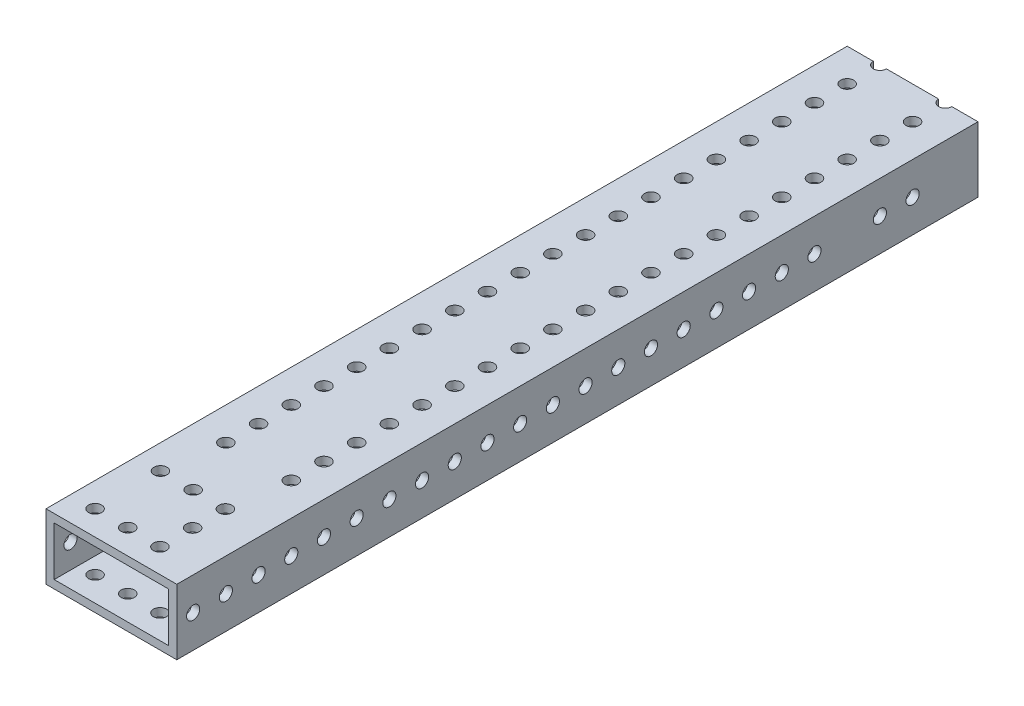
from build123d import *

# Parameters (mm, degrees)
SKETCH1_W           = 50.8
SKETCH1_H           = 25.4
SKETCH1_W_2         = 44.45
SKETCH1_H_2         = 19.05
BOSS_EXTRUDE1_DEPTH = 234.95
SKETCH6_R           = 2.5527
CUT_EXTRUDE5_DEPTH  = 241.714421047
SKETCH5_W           = 63.5
SKETCH5_H           = 25.4
CUT_EXTRUDE6_DEPTH  = 241.714421047
SKETCH2_R           = 2.5527
CUT_EXTRUDE1_DEPTH  = 238.680084357
SKETCH7_W           = 95.25
SKETCH7_H           = 25.4
CUT_EXTRUDE7_DEPTH  = 241.714421047


with BuildPart() as part:
    # Sketch1 → Boss-Extrude1 (new, symmetric)
    with BuildSketch(Plane.XY):
        Rectangle(SKETCH1_W, SKETCH1_H)
        Rectangle(SKETCH1_W_2, SKETCH1_H_2, mode=Mode.SUBTRACT)
    extrude(amount=BOSS_EXTRUDE1_DEPTH, both=True)

    # Sketch6 → Cut-Extrude5 (cut, through all)
    with BuildSketch(Plane(origin=(25.4, 0, 0), x_dir=(0, 0, -1), z_dir=(1, 0, 0))):
        with Locations((-228.6, 0)):
            Circle(SKETCH6_R)
        with Locations((-215.9, 0)):
            Circle(SKETCH6_R)
        with Locations((-203.2, 0)):
            Circle(SKETCH6_R)
        with Locations((-190.5, 0)):
            Circle(SKETCH6_R)
        with Locations((-177.8, 0)):
            Circle(SKETCH6_R)
        with Locations((-165.1, 0)):
            Circle(SKETCH6_R)
        with Locations((-152.4, 0)):
            Circle(SKETCH6_R)
        with Locations((-139.7, 0)):
            Circle(SKETCH6_R)
        with Locations((-127, 0)):
            Circle(SKETCH6_R)
        with Locations((-114.3, 0)):
            Circle(SKETCH6_R)
        with Locations((-101.6, 0)):
            Circle(SKETCH6_R)
        with Locations((-88.9, 0)):
            Circle(SKETCH6_R)
        with Locations((-76.2, 0)):
            Circle(SKETCH6_R)
        with Locations((-63.5, 0)):
            Circle(SKETCH6_R)
        with Locations((-50.8, 0)):
            Circle(SKETCH6_R)
        with Locations((-38.1, 0)):
            Circle(SKETCH6_R)
        with Locations((-25.4, 0)):
            Circle(SKETCH6_R)
        with Locations((-12.7, 0)):
            Circle(SKETCH6_R)
        Circle(SKETCH6_R)
        with Locations((12.7, 0)):
            Circle(SKETCH6_R)
        with Locations((38.1, 0)):
            Circle(SKETCH6_R)
        with Locations((50.8, 0)):
            Circle(SKETCH6_R)
    extrude(amount=-CUT_EXTRUDE5_DEPTH, mode=Mode.SUBTRACT)

    # Sketch5 → Cut-Extrude6 (cut, through all)
    with BuildSketch(Plane.ZY.offset(25.4)):
        with Locations((-203.2, 0)):
            Rectangle(SKETCH5_W, SKETCH5_H)
    extrude(amount=-CUT_EXTRUDE6_DEPTH, mode=Mode.SUBTRACT)

    # Sketch2 → Cut-Extrude1 (cut, through all)
    with BuildSketch(Plane(origin=(0, 12.7, 0), x_dir=(1, 0, 0), z_dir=(0, 1, 0))):
        with Locations((-12.7, -177.8)):
            Circle(SKETCH2_R)
        with Locations((-12.7, -165.1)):
            Circle(SKETCH2_R)
        with Locations((-12.7, -152.4)):
            Circle(SKETCH2_R)
        with Locations((-12.7, -139.7)):
            Circle(SKETCH2_R)
        with Locations((-12.7, -127)):
            Circle(SKETCH2_R)
        with Locations((-12.7, -114.3)):
            Circle(SKETCH2_R)
        with Locations((-12.7, -101.6)):
            Circle(SKETCH2_R)
        with Locations((-12.7, -88.9)):
            Circle(SKETCH2_R)
        with Locations((-12.7, -76.2)):
            Circle(SKETCH2_R)
        with Locations((-12.7, -63.5)):
            Circle(SKETCH2_R)
        with Locations((-12.7, -50.8)):
            Circle(SKETCH2_R)
        with Locations((-12.7, -38.1)):
            Circle(SKETCH2_R)
        with Locations((-12.7, -25.4)):
            Circle(SKETCH2_R)
        with Locations((-12.7, -12.7)):
            Circle(SKETCH2_R)
        with Locations((-12.7, 0)):
            Circle(SKETCH2_R)
        with Locations((-12.7, 12.7)):
            Circle(SKETCH2_R)
        with Locations((-12.7, 25.4)):
            Circle(SKETCH2_R)
        with Locations((12.7, 25.4)):
            Circle(SKETCH2_R)
        with Locations((-12.7, 38.1)):
            Circle(SKETCH2_R)
        with Locations((-12.7, 50.8)):
            Circle(SKETCH2_R)
        with Locations((-12.7, 63.5)):
            Circle(SKETCH2_R)
        with Locations((12.7, 63.5)):
            Circle(SKETCH2_R)
        with Locations((-12.7, 76.2)):
            Circle(SKETCH2_R)
        with Locations((12.7, 76.2)):
            Circle(SKETCH2_R)
        with Locations((-12.7, 88.9)):
            Circle(SKETCH2_R)
        with Locations((-12.7, 101.6)):
            Circle(SKETCH2_R)
        with Locations((-12.7, 114.3)):
            Circle(SKETCH2_R)
        with Locations((-12.7, 139.7)):
            Circle(SKETCH2_R)
        with Locations((-12.7, 152.4)):
            Circle(SKETCH2_R)
        with Locations((-12.7, 165.1)):
            Circle(SKETCH2_R)
        with Locations((-12.7, 177.8)):
            Circle(SKETCH2_R)
        with Locations((-12.7, 190.5)):
            Circle(SKETCH2_R)
        with Locations((-12.7, 203.2)):
            Circle(SKETCH2_R)
        with Locations((-12.7, 215.9)):
            Circle(SKETCH2_R)
        with Locations((-12.7, 228.6)):
            Circle(SKETCH2_R)
        with Locations((-12.7, 241.3)):
            Circle(SKETCH2_R)
        with Locations((-12.7, 254)):
            Circle(SKETCH2_R)
        with Locations((-12.7, 266.7)):
            Circle(SKETCH2_R)
        with Locations((-12.7, 279.4)):
            Circle(SKETCH2_R)
        with Locations((-12.7, 292.1)):
            Circle(SKETCH2_R)
        with Locations((-12.7, 304.8)):
            Circle(SKETCH2_R)
        with Locations((-12.7, 317.5)):
            Circle(SKETCH2_R)
        with Locations((-12.7, 330.2)):
            Circle(SKETCH2_R)
        with Locations((-12.7, 342.9)):
            Circle(SKETCH2_R)
        with Locations((-12.7, 355.6)):
            Circle(SKETCH2_R)
        with Locations((12.7, -177.8)):
            Circle(SKETCH2_R)
        with Locations((12.7, -165.1)):
            Circle(SKETCH2_R)
        with Locations((12.7, -152.4)):
            Circle(SKETCH2_R)
        with Locations((12.7, -139.7)):
            Circle(SKETCH2_R)
        with Locations((12.7, -127)):
            Circle(SKETCH2_R)
        with Locations((12.7, -114.3)):
            Circle(SKETCH2_R)
        with Locations((12.7, -101.6)):
            Circle(SKETCH2_R)
        with Locations((12.7, -88.9)):
            Circle(SKETCH2_R)
        with Locations((12.7, -76.2)):
            Circle(SKETCH2_R)
        with Locations((12.7, -63.5)):
            Circle(SKETCH2_R)
        with Locations((12.7, -50.8)):
            Circle(SKETCH2_R)
        with Locations((12.7, -38.1)):
            Circle(SKETCH2_R)
        with Locations((12.7, -25.4)):
            Circle(SKETCH2_R)
        with Locations((12.7, -12.7)):
            Circle(SKETCH2_R)
        with Locations((12.7, 0)):
            Circle(SKETCH2_R)
        with Locations((12.7, 12.7)):
            Circle(SKETCH2_R)
        with Locations((12.7, 38.1)):
            Circle(SKETCH2_R)
        with Locations((12.7, 50.8)):
            Circle(SKETCH2_R)
        with Locations((12.7, 88.9)):
            Circle(SKETCH2_R)
        with Locations((12.7, 101.6)):
            Circle(SKETCH2_R)
        with Locations((12.7, 114.3)):
            Circle(SKETCH2_R)
        with Locations((12.7, 139.7)):
            Circle(SKETCH2_R)
        with Locations((12.7, 152.4)):
            Circle(SKETCH2_R)
        with Locations((12.7, 165.1)):
            Circle(SKETCH2_R)
        with Locations((12.7, 177.8)):
            Circle(SKETCH2_R)
        with Locations((12.7, 190.5)):
            Circle(SKETCH2_R)
        with Locations((12.7, 203.2)):
            Circle(SKETCH2_R)
        with Locations((12.7, 215.9)):
            Circle(SKETCH2_R)
        with Locations((12.7, 228.6)):
            Circle(SKETCH2_R)
        with Locations((12.7, 241.3)):
            Circle(SKETCH2_R)
        with Locations((12.7, 254)):
            Circle(SKETCH2_R)
        with Locations((12.7, 266.7)):
            Circle(SKETCH2_R)
        with Locations((12.7, 279.4)):
            Circle(SKETCH2_R)
        with Locations((12.7, 292.1)):
            Circle(SKETCH2_R)
        with Locations((12.7, 304.8)):
            Circle(SKETCH2_R)
        with Locations((12.7, 317.5)):
            Circle(SKETCH2_R)
        with Locations((12.7, 330.2)):
            Circle(SKETCH2_R)
        with Locations((12.7, 342.9)):
            Circle(SKETCH2_R)
        with Locations((12.7, 355.6)):
            Circle(SKETCH2_R)
        with Locations((12.7, 368.3)):
            Circle(SKETCH2_R)
        with Locations((12.7, 381)):
            Circle(SKETCH2_R)
        with Locations((12.7, 393.7)):
            Circle(SKETCH2_R)
        with Locations((-15.875, -225.425)):
            Circle(SKETCH2_R)
        with Locations((-15.875, -200.025)):
            Circle(SKETCH2_R)
        with Locations((-3.175, -200.025)):
            Circle(SKETCH2_R)
        with Locations((-3.175, -225.425)):
            Circle(SKETCH2_R)
        with Locations((9.525, -225.6155)):
            Circle(SKETCH2_R)
        with Locations((9.525, -212.9155)):
            Circle(SKETCH2_R)
        with Locations((9.525, -200.2155)):
            Circle(SKETCH2_R)
    extrude(amount=-CUT_EXTRUDE1_DEPTH, mode=Mode.SUBTRACT)

    # Sketch7 → Cut-Extrude7 (cut, through all)
    with BuildSketch(Plane.ZY.offset(25.4)):
        with Locations((-123.825, 0)):
            Rectangle(SKETCH7_W, SKETCH7_H)
    extrude(amount=-CUT_EXTRUDE7_DEPTH, mode=Mode.SUBTRACT)


solid = part.part
